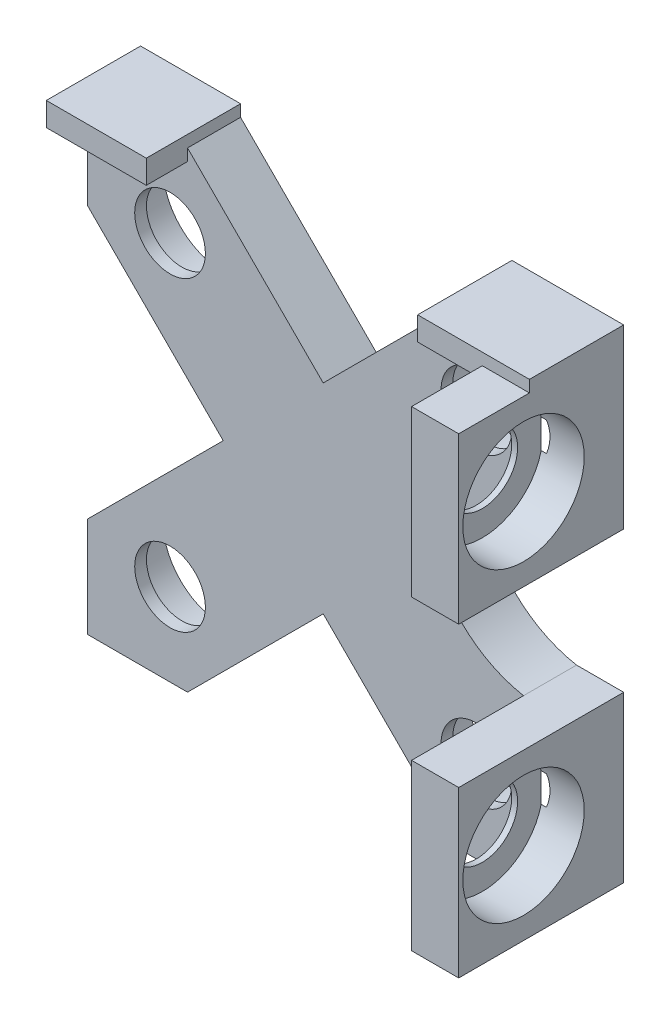
from build123d import *

# Parameters (mm, degrees)
RESSALTO_EXTRUS_O1_DEPTH      = 4.5
CORTE_EXTRUS_O1_START         = -4.5
ESBO_O2_R                     = 5.1
CORTE_EXTRUS_O1_DEPTH         = 3.5
ESBO_O3_R                     = 3
CORTE_EXTRUS_O2_DEPTH         = 3.5
ESPELHAR2_COPY_1_DEPTH        = 4.5
ESPELHAR2_START               = -4.5
ESPELHAR2_COPY_2_SKETCH_R     = 5.1
ESPELHAR2_COPY_2_DEPTH        = 3.5
ESPELHAR2_COPY_3_SKETCH_R     = 3
ESPELHAR2_COPY_3_DEPTH        = 3.5
RESSALTO_EXTRUS_O2_START      = -3
ESBO_O5_W                     = 14
ESBO_O5_H                     = 14
RESSALTO_EXTRUS_O2_DEPTH      = 4
ESBO_O6_R                     = 5.15
CORTE_EXTRUS_O3_DEPTH         = 3.5
ESBO_O7_R                     = 3
CORTE_EXTRUS_O4_DEPTH         = 45.746508244
FILETE1_R                     = 10
RESSALTO_EXTRUS_O3_DEPTH      = 1
RESSALTO_EXTRUS_O3_DEPTH_BACK = 1
ESBO_O8_W                     = 8.485281374
ESBO_O8_H                     = 8
ESBO_O8_W_2                   = 9.485281374
ESPELHAR5_START               = -4.5
ESPELHAR5_COPY_1_SKETCH_R     = 5.1
ESPELHAR5_COPY_1_DEPTH        = 3.5
ESPELHAR5_COPY_2_SKETCH_R     = 5.1
ESPELHAR5_COPY_2_DEPTH        = 3.5


with BuildPart() as part:
    # Esboço1 → Ressalto-extrusão1 (new body)
    with BuildSketch(Plane.XY):
        Polygon((-8.485281374, 0), (-20, 11.514718626), (-20, 20), (-11.514718626, 20), (0, 8.485281374), (0, 0), align=None)
    ressalto_extrus_o1 = extrude(amount=RESSALTO_EXTRUS_O1_DEPTH)

    # Esboço2 → Corte-extrusão1 (cut)
    with BuildSketch(Plane.XY.offset(4.5).offset(CORTE_EXTRUS_O1_START)):
        with Locations((-13, 13)):
            Circle(ESBO_O2_R)
    corte_extrus_o1 = extrude(amount=CORTE_EXTRUS_O1_DEPTH, mode=Mode.SUBTRACT)

    # Esboço3 → Corte-extrusão2 (cut)
    with BuildSketch(Plane(origin=(0, 0, 3.5), x_dir=(-1, 0, 0), z_dir=(0, 0, -1))):
        with Locations((13, 13)):
            Circle(ESBO_O3_R)
    corte_extrus_o2 = extrude(amount=-CORTE_EXTRUS_O2_DEPTH, mode=Mode.SUBTRACT)

    # Espelhar1: Ressalto-extrusão1, Corte-extrusão1, Corte-extrusão2 across plane
    add(ressalto_extrus_o1.mirror(Plane(origin=(0, 0, 0), x_dir=(0, 0, 1), z_dir=(1, 0, 0))))
    add(corte_extrus_o1.mirror(Plane(origin=(0, 0, 0), x_dir=(0, 0, 1), z_dir=(1, 0, 0))), mode=Mode.SUBTRACT)
    add(corte_extrus_o2.mirror(Plane(origin=(0, 0, 0), x_dir=(0, 0, 1), z_dir=(1, 0, 0))), mode=Mode.SUBTRACT)

    # Espelhar2: Ressalto-extrusão1, Corte-extrusão1, Corte-extrusão2 across plane
    add(ressalto_extrus_o1.mirror(Plane.ZX))
    add(corte_extrus_o1.mirror(Plane.ZX), mode=Mode.SUBTRACT)
    add(corte_extrus_o2.mirror(Plane.ZX), mode=Mode.SUBTRACT)

    # Espelhar2 copy 1 sketch → Espelhar2 copy 1 (add)
    with BuildSketch(Plane(origin=(0, 0, 0), x_dir=(-1, 0, 0), z_dir=(0, 0, 1))):
        Polygon((-8.485281374, 0), (-20, 11.514718626), (-20, 20), (-11.514718626, 20), (0, 8.485281374), (0, 0), align=None)
    extrude(amount=ESPELHAR2_COPY_1_DEPTH)

    # Espelhar2 copy 2 sketch → Espelhar2 copy 2 (cut)
    with BuildSketch(Plane(origin=(0, 0, 4.5), x_dir=(-1, 0, 0), z_dir=(0, 0, 1)).offset(ESPELHAR2_START)):
        with Locations((-13, 13)):
            Circle(ESPELHAR2_COPY_2_SKETCH_R)
    extrude(amount=ESPELHAR2_COPY_2_DEPTH, mode=Mode.SUBTRACT)

    # Espelhar2 copy 3 sketch → Espelhar2 copy 3 (cut)
    with BuildSketch(Plane(origin=(0, 0, 3.5), x_dir=(1, 0, 0), z_dir=(0, 0, -1))):
        with Locations((13, 13)):
            Circle(ESPELHAR2_COPY_3_SKETCH_R)
    extrude(amount=-ESPELHAR2_COPY_3_DEPTH, mode=Mode.SUBTRACT)

    # Esboço5 → Ressalto-extrusão2 (add)
    with BuildSketch(Plane(origin=(20, 0, 0), x_dir=(0, 0, -1), z_dir=(1, 0, 0)).offset(RESSALTO_EXTRUS_O2_START)):
        with Locations((-7, 13)):
            Rectangle(ESBO_O5_W, ESBO_O5_H)
    ressalto_extrus_o2 = extrude(amount=RESSALTO_EXTRUS_O2_DEPTH)

    # Esboço6 → Corte-extrusão3 (cut)
    with BuildSketch(Plane.ZY.offset(-21)):
        with Locations((8.5, 13)):
            Circle(ESBO_O6_R)
    corte_extrus_o3 = extrude(amount=CORTE_EXTRUS_O3_DEPTH, mode=Mode.SUBTRACT)

    # Esboço7 → Corte-extrusão4 (cut, symmetric)
    with BuildSketch(Plane(origin=(17.5, 0, 0), x_dir=(0, 0, -1), z_dir=(1, 0, 0))):
        with Locations(Location((-8.5, 13, 0), (0, 0, 180))):
            Circle(ESBO_O7_R)
    corte_extrus_o4 = extrude(amount=CORTE_EXTRUS_O4_DEPTH, both=True, mode=Mode.SUBTRACT)

    # Espelhar3: Ressalto-extrusão2, Corte-extrusão3, Corte-extrusão4 across plane
    add(ressalto_extrus_o2.mirror(Plane.ZX))
    add(corte_extrus_o3.mirror(Plane.ZX), mode=Mode.SUBTRACT)
    add(corte_extrus_o4.mirror(Plane.ZX), mode=Mode.SUBTRACT)

    # Filete1
    # the kernel refuses this fillet: 10 mm, written as the material it adds along each edge
    with BuildSketch(Plane(origin=(17, 8.514718626, 4.5), x_dir=(0, -1, 0), z_dir=(0, 0, -1))) as filete1_piece_1:
        with BuildLine():
            CenterArc((12.353448055, -1.788687569), FILETE1_R, 135, 34.696124969)
            Line((5.282380243, 5.282380243), (0, 0))
            Line((0, 0), (2.514718626, 0))
        make_face()
    extrude(amount=4.5)
    with BuildSketch(Plane(origin=(17, -8.514718626, 0), x_dir=(-0.7071067811865464, 0.7071067811865487, 0), z_dir=(0, 0, 1))) as filete1_piece_2:
        with BuildLine():
            CenterArc((7.470413781, -10), FILETE1_R, 90, 34.696124969)
            Line((1.778174593, -1.778174593), (0, 0))
            Line((0, 0), (7.470413781, 0))
        make_face()
    extrude(amount=4.5)

    # Esboço8 → Ressalto-extrusão3 (add, two sides: drawn at the far end of the back side and taken through both)
    with BuildSketch(Plane(origin=(0, 20, 0), x_dir=(1, 0, 0), z_dir=(0, 1, 0)).offset(-RESSALTO_EXTRUS_O3_DEPTH_BACK)):
        with Locations((-15.757359313, -4)):
            Rectangle(ESBO_O8_W, ESBO_O8_H)
        with Locations((16.257359313, -4)):
            Rectangle(ESBO_O8_W_2, ESBO_O8_H)
    extrude(amount=RESSALTO_EXTRUS_O3_DEPTH + RESSALTO_EXTRUS_O3_DEPTH_BACK)

    # Espelhar4: Corte-extrusão1 across plane
    add(corte_extrus_o1.mirror(Plane(origin=(0, 0, 0), x_dir=(0, 0, 1), z_dir=(1, 0, 0))), mode=Mode.SUBTRACT)

    # Espelhar5 copy 1 sketch → Espelhar5 copy 1 (cut)
    with BuildSketch(Plane(origin=(0, 0, 4.5), x_dir=(-1, 0, 0), z_dir=(0, 0, 1)).offset(ESPELHAR5_START)):
        with Locations((-13, 13)):
            Circle(ESPELHAR5_COPY_1_SKETCH_R)
    extrude(amount=ESPELHAR5_COPY_1_DEPTH, mode=Mode.SUBTRACT)

    # Espelhar5 copy 2 sketch → Espelhar5 copy 2 (cut)
    with BuildSketch(Plane.XY.offset(4.5).offset(ESPELHAR5_START)):
        with Locations((-13, -13)):
            Circle(ESPELHAR5_COPY_2_SKETCH_R)
    extrude(amount=ESPELHAR5_COPY_2_DEPTH, mode=Mode.SUBTRACT)


solid = part.part
